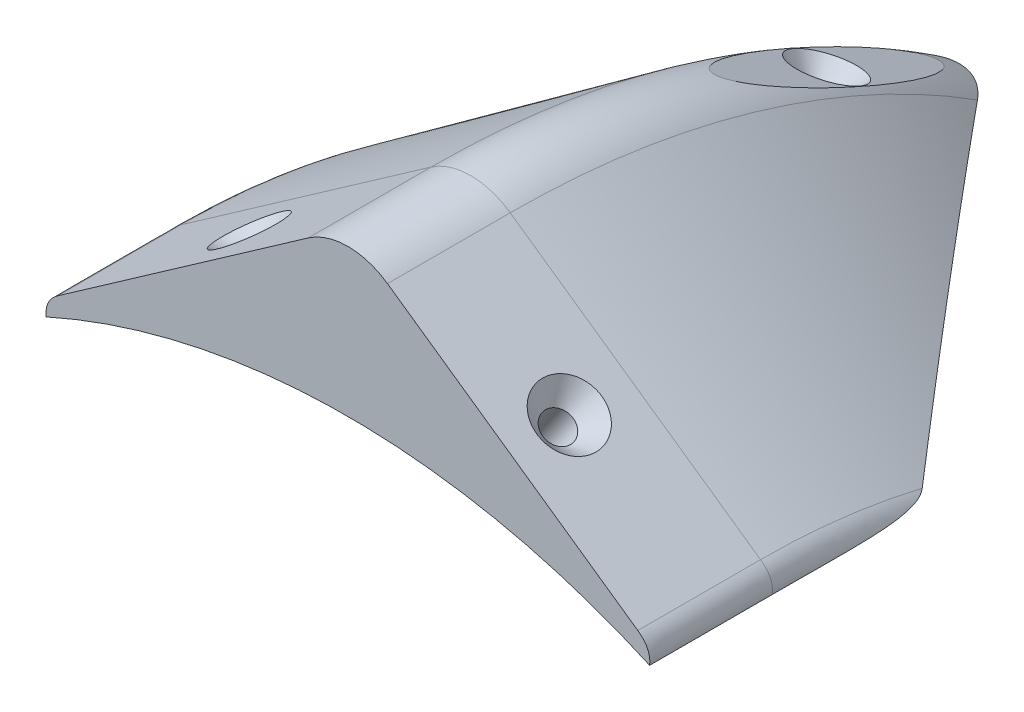
from build123d import *

# Parameters (mm, degrees)
REVOLVE1_ANGLE      = 57
BOSS_EXTRUDE1_DEPTH = 25.4
CUT_EXTRUDE3_START  = -257.048
SKETCH8_R           = 152.4
CUT_EXTRUDE3_DEPTH  = 257.048
SKETCH13_W          = 16.387620484
SKETCH13_H          = 127
CUT_EXTRUDE5_DEPTH  = 1.778


with BuildPart() as part:
    # Sketch1 → Revolve1 (revolve)
    with BuildSketch(Plane.XY):
        with BuildLine():
            Line((-59.991213716, 144.035687339), (-8.193810242, 180.296949153))
            ThreePointArc((-8.193810242, 180.296949153), (0, 182.88), (8.193810242, 180.296949153))
            Line((8.193810242, 180.296949153), (59.991213716, 144.035687339))
            add(Edge.make_bspline(
                [(59.991213716, 144.035687339), (62.78248672, 142.0840471), (62.441206007, 139.021062406)],
                knots=[0, 0, 0, 1, 1, 1], degree=2))
            ThreePointArc((62.441206007, 139.021062406), (0, 152.4), (-62.441206007, 139.021062406))
            add(Edge.make_bspline(
                [(-59.991213716, 144.035687339), (-62.78248672, 142.0840471), (-62.441206007, 139.021062406)],
                knots=[0, 0, 0, 1, 1, 1], degree=2))
        make_face()
    revolve(axis=Axis((0, 0, 0), (-1, 0, 0)), revolution_arc=REVOLVE1_ANGLE)

    # Sketch3 → Boss-Extrude1 (add)
    with BuildSketch(Plane.XY):
        with BuildLine():
            Line((-59.991213716, 144.035687339), (-8.193810242, 180.296949153))
            ThreePointArc((-8.193810242, 180.296949153), (0, 182.88), (8.193810242, 180.296949153))
            Line((8.193810242, 180.296949153), (59.991213716, 144.035687339))
            add(Edge.make_bspline(
                [(59.991213716, 144.035687339), (62.78248672, 142.0840471), (62.441206007, 139.021062406)],
                knots=[0, 0, 0, 1, 1, 1], degree=2))
            ThreePointArc((62.441206007, 139.021062406), (0, 152.4), (-62.441206007, 139.021062406))
            add(Edge.make_bspline(
                [(-59.991213716, 144.035687339), (-62.78248672, 142.0840471), (-62.441206007, 139.021062406)],
                knots=[0, 0, 0, 1, 1, 1], degree=2))
        make_face()
    extrude(amount=BOSS_EXTRUDE1_DEPTH)

    # Sketch7 → Cut-Revolve2 (revolve, cut)
    with BuildSketch(Plane.XY.offset(12.7)):
        Polygon((-18.85509192, 148.029004366), (-21.456080621, 146.208157646), (-33.109499632, 162.854485329), (-27.584999632, 166.721963764), (-28.163260355, 161.325258604), align=None)
    cut_revolve2 = revolve(axis=Axis((-21.456080621, 146.208157646, 12.7), (-0.5734950300768231, 0.8192090395480165, 0)), mode=Mode.SUBTRACT)

    # Mirror2: Cut-Revolve2 across plane
    add(cut_revolve2.mirror(Plane(origin=(0, 0, 0), x_dir=(0, 0, 1), z_dir=(1, 0, 0))), mode=Mode.SUBTRACT)

    # Sketch8 → Cut-Extrude3 (cut)
    with BuildSketch(Plane.XY.offset(25.4).offset(CUT_EXTRUDE3_START)):
        Circle(SKETCH8_R)
    extrude(amount=CUT_EXTRUDE3_DEPTH, mode=Mode.SUBTRACT)

    # Sketch13 → Cut-Extrude5 (cut)
    with BuildSketch(Plane(origin=(0, 167.069193294, -74.383997286), x_dir=(1, 0, 0), z_dir=(0, 0.9135454576426008, -0.40673664307580043))):
        Rectangle(SKETCH13_W, SKETCH13_H)
    extrude(amount=-CUT_EXTRUDE5_DEPTH, mode=Mode.SUBTRACT)

    # Sketch14 → Cut-Revolve4 (revolve, cut)
    with BuildSketch(Plane(origin=(0, 0, 0), x_dir=(0, 0, -1), z_dir=(1, 0, 0))):
        Polygon((73.660819534, 165.44490947), (67.500143032, 168.18781937), (69.097003878, 163.000445517), (60.429201972, 143.532243688), (63.3297088, 142.240854846), align=None)
    revolve(axis=Axis((0, 165.44490947, -73.660819534), (0, -0.9135454576426005, 0.406736643075801)), mode=Mode.SUBTRACT)


solid = part.part
